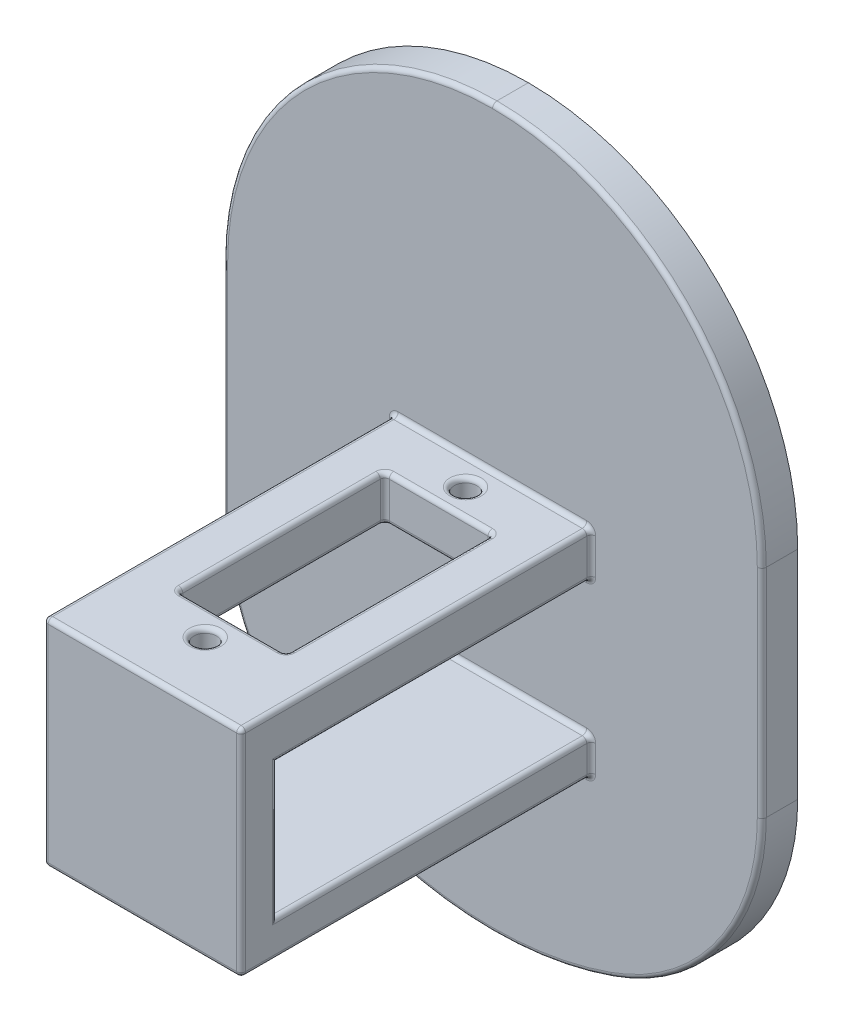
from build123d import *

# Parameters (mm, degrees)
SKETCH1_R           = 40
BOSS_EXTRUDE1_DEPTH = 4
CUT_EXTRUDE3_START  = -10
CUT_EXTRUDE3_DEPTH  = 10
FILLET1_R           = 30
FILLET2_R           = 25
SKETCH4_W           = 22
SKETCH4_H           = 5
BOSS_EXTRUDE2_DEPTH = 35
SKETCH5_W           = 12
SKETCH5_H           = 23
CUT_EXTRUDE1_DEPTH  = 5
SKETCH6_R           = 1.25
CUT_EXTRUDE2_DEPTH  = 5
SKETCH7_W           = 22
SKETCH7_H           = 20
BOSS_EXTRUDE3_DEPTH = 4
SKETCH8_W           = 22
SKETCH8_H           = 39
BOSS_EXTRUDE4_DEPTH = 4
SKETCH9_R           = 3.75
BOSS_EXTRUDE5_DEPTH = 7
FILLET3_R           = 0.5
FILLET4_R           = 0.5


with BuildPart() as part:
    # Sketch1 → Boss-Extrude1 (new body)
    with BuildSketch(Plane.XY):
        Circle(SKETCH1_R)
    extrude(amount=BOSS_EXTRUDE1_DEPTH)

    # Sketch10 → Cut-Extrude3 (cut)
    with BuildSketch(Plane.XY.offset(4).offset(CUT_EXTRUDE3_START)):
        with BuildLine():
            Line((-30, 26.457513111), (-30, -26.457513111))
            ThreePointArc((-30, -26.457513111), (-40, 0), (-30, 26.457513111))
        make_face()
        with BuildLine():
            Line((30, 26.457513111), (30, -26.457513111))
            ThreePointArc((30, -26.457513111), (40, 0), (30, 26.457513111))
        make_face()
    extrude(amount=CUT_EXTRUDE3_DEPTH, mode=Mode.SUBTRACT)

    # Fillet1
    fillet1_edges = [part.edges().sort_by_distance(p)[0] for p in [
        (-30, 26.457513111, 2),
        (30, 26.457513111, 2),
    ]]
    fillet(fillet1_edges, radius=FILLET1_R - 0.0001)  # a hair under: the kernel refuses the full size

    # Fillet2
    fillet2_edges = [part.edges().sort_by_distance(p)[0] for p in [
        (-30, -26.457513111, 2),
        (30, -26.457513111, 2),
    ]]
    fillet(fillet2_edges, radius=FILLET2_R)

    # Sketch4 → Boss-Extrude2 (add)
    with BuildSketch(Plane.XY.offset(4)):
        with Locations((0, 2)):
            Rectangle(SKETCH4_W, SKETCH4_H)
    extrude(amount=BOSS_EXTRUDE2_DEPTH)

    # Sketch5 → Cut-Extrude1 (cut)
    with BuildSketch(Plane(origin=(0, 4.5, 0), x_dir=(1, 0, 0), z_dir=(0, 1, 0))):
        with Locations((0, -21.5)):
            Rectangle(SKETCH5_W, SKETCH5_H)
    extrude(amount=-CUT_EXTRUDE1_DEPTH, mode=Mode.SUBTRACT)

    # Sketch6 → Cut-Extrude2 (cut)
    with BuildSketch(Plane(origin=(0, 4.5, 0), x_dir=(1, 0, 0), z_dir=(0, 1, 0))):
        with Locations(Location((0, -7, 0), (0, 0, 270))):
            Circle(SKETCH6_R)
        with Locations(Location((0, -36, 0), (0, 0, 270))):
            Circle(SKETCH6_R)
    extrude(amount=-CUT_EXTRUDE2_DEPTH, mode=Mode.SUBTRACT)

    # Sketch7 → Boss-Extrude3 (add)
    with BuildSketch(Plane.XY.offset(39)):
        with Locations((0, -5.5)):
            Rectangle(SKETCH7_W, SKETCH7_H)
    extrude(amount=BOSS_EXTRUDE3_DEPTH)

    # Sketch8 → Boss-Extrude4 (add)
    with BuildSketch(Plane.XZ.offset(15.5)):
        with Locations((0, 23.5)):
            Rectangle(SKETCH8_W, SKETCH8_H)
    extrude(amount=BOSS_EXTRUDE4_DEPTH)

    # Sketch9 → Boss-Extrude5 (add)
    with BuildSketch(Plane.XZ.offset(19.5)):
        with Locations(Location((0, 26.5, 0), (0, 0, 270))):
            Circle(SKETCH9_R)
    extrude(amount=BOSS_EXTRUDE5_DEPTH)

    # Fillet3
    fillet3_edges = [part.edges().sort_by_distance(p)[0] for p in [
        (-11, -15.5, 21.5),
        (0, -15.5, 4),
        (-11, -17.5, 4),
        (11, -15.5, 21.5),
        (11, -17.5, 4),
        (-11, -19.5, 23.5),
        (0, -19.5, 4),
        (11, -19.5, 23.5),
        (0, -19.5, 43),
        (0, -19.5, 30.25),
        (0, -26.5, 30.25),
        (30, -2.071017812, 4),
        (21.213338789, 31.21312666, 4),
        (-21.213338789, 31.21312666, 4),
        (-30, -2.071017812, 4),
        (0, -40, 4),
        (25.412414523, -28.575892353, 4),
        (-25.412414523, -28.575892353, 4),
        (11, 2, 4),
        (11, -0.5, 21.5),
        (0, 4.5, 4),
        (11, 4.5, 23.5),
        (-11, 2, 4),
        (-11, 4.5, 23.5),
        (0, -0.5, 4),
        (-11, -0.5, 21.5),
        (6, -0.5, 21.5),
        (6, 2, 10),
        (0, -0.5, 33),
        (6, 2, 33),
        (-6, -0.5, 21.5),
        (-6, 2, 33),
        (0, -0.5, 10),
        (-6, 2, 10),
        (6, 4.5, 21.5),
        (0, 4.5, 10),
        (-6, 4.5, 21.5),
        (0, 4.5, 33),
        (-11, -8, 39),
        (11, -8, 39),
        (-11, -7.5, 43),
        (11, -7.5, 43),
        (0, 4.5, 43),
    ]]
    fillet(fillet3_edges, radius=FILLET3_R)

    # Fillet4
    fillet4_edges = [part.edges().sort_by_distance(p)[0] for p in [
        (0, 4.5, 5.75),
        (0, 4.5, 34.75),
    ]]
    fillet(fillet4_edges, radius=FILLET4_R)


solid = part.part
